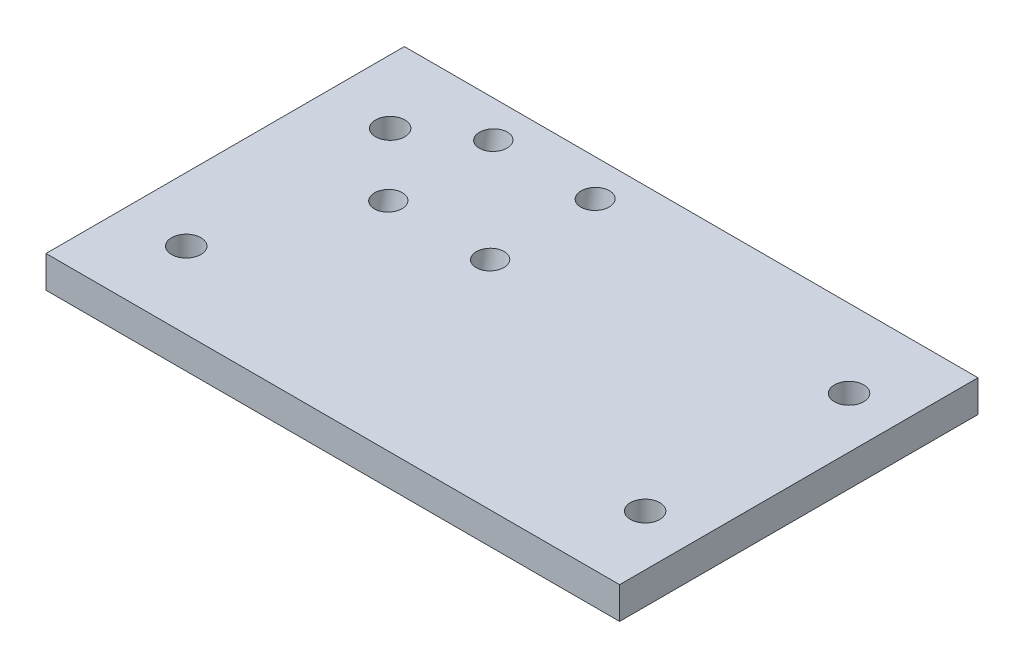
from build123d import *

# Parameters (mm, degrees)
SKETCH1_W           = 90
SKETCH1_H           = 56.23
BOSS_EXTRUDE1_DEPTH = 5
SKETCH2_R           = 2.3
CUT_EXTRUDE1_DEPTH  = 15
SKETCH7_R           = 2.3
CUT_EXTRUDE3_DEPTH  = 45
SKETCH10_R          = 2.159579804
SKETCH10_R_2        = 2.2
CUT_EXTRUDE4_DEPTH  = 10


with BuildPart() as part:
    # Sketch1 → Boss-Extrude1 (new body)
    with BuildSketch(Plane(origin=(0, 0, 0), x_dir=(1, 0, 0), z_dir=(0, 1, 0))):
        with Locations((45, 28.115)):
            Rectangle(SKETCH1_W, SKETCH1_H)
    extrude(amount=BOSS_EXTRUDE1_DEPTH)

    # Sketch2 → Cut-Extrude1 (cut)
    with BuildSketch(Plane(origin=(0, 5, 0), x_dir=(1, 0, 0), z_dir=(0, 1, 0))):
        with Locations((82, 12)):
            Circle(SKETCH2_R)
        with Locations((10, 12)):
            Circle(SKETCH2_R)
    extrude(amount=-CUT_EXTRUDE1_DEPTH, mode=Mode.SUBTRACT)

    # Sketch7 → Cut-Extrude3 (cut)
    with BuildSketch(Plane(origin=(0, 5, 0), x_dir=(1, 0, 0), z_dir=(0, 1, 0))):
        with Locations((82, 44)):
            Circle(SKETCH7_R)
        with Locations((10, 44)):
            Circle(SKETCH7_R)
    extrude(amount=-CUT_EXTRUDE3_DEPTH, mode=Mode.SUBTRACT)

    # Sketch10 → Cut-Extrude4 (cut)
    with BuildSketch(Plane(origin=(0, 15.35002401, -2.983742412), x_dir=(-1, 0, 0), z_dir=(0, 0.9816271834476639, -0.19080899537654525))):
        with Locations((-35.67114259, -32.435500466)):
            Circle(SKETCH10_R)
        with Locations((-19.691153342, -32.435500466)):
            Circle(SKETCH10_R)
        with Locations((-19.691153342, -48.610249106)):
            Circle(SKETCH10_R)
        with Locations((-35.67114259, -48.610249106)):
            Circle(SKETCH10_R_2)
    extrude(amount=-CUT_EXTRUDE4_DEPTH, mode=Mode.SUBTRACT)


solid = part.part
